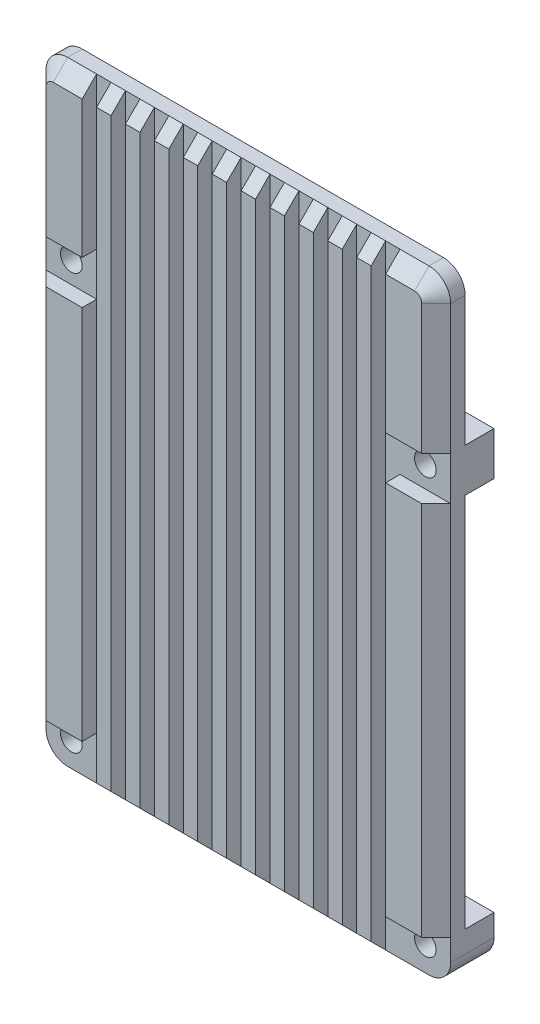
from build123d import *

# Parameters (mm, degrees)
SKETCH_4_R          = 1.5
EXTRUDE_1_DEPTH     = 4
CHAMFER_1_SIZE      = 2
SKETCH_5_W          = 2
SKETCH_5_H          = 85
CUT_EXTRUDE_1_DEPTH = 2
EXTRUDE_START       = 4
SKETCH_6_W          = 7
SKETCH_6_H          = 6
SKETCH_6_R          = 1.5
EXTRUDE_2_DEPTH     = 4


with BuildPart() as part:
    # 草图4 → 凸台-拉伸1 (new body)
    with BuildSketch(Plane.XY):
        with BuildLine():
            Line((0, 3), (0, 82))
            ThreePointArc((0, 82), (0.878679656, 84.121320344), (3, 85))
            Line((3, 85), (53, 85))
            ThreePointArc((53, 85), (55.121320344, 84.121320344), (56, 82))
            Line((56, 82), (56, 3))
            ThreePointArc((56, 3), (55.121320344, 0.878679656), (53, 0))
            Line((53, 0), (3, 0))
            ThreePointArc((3, 0), (0.878679656, 0.878679656), (0, 3))
        make_face()
        with Locations((3.5, 3.5)):
            Circle(SKETCH_4_R, mode=Mode.SUBTRACT)
        with Locations((52.5, 3.5)):
            Circle(SKETCH_4_R, mode=Mode.SUBTRACT)
        with Locations((52.5, 61)):
            Circle(SKETCH_4_R, mode=Mode.SUBTRACT)
        with Locations((3.5, 61)):
            Circle(SKETCH_4_R, mode=Mode.SUBTRACT)
    extrude(amount=EXTRUDE_1_DEPTH)

    # 倒角1
    chamfer_1_edges = [part.edges().sort_by_distance(p)[0] for p in [
        (55.121320344, 0.878679656, 4),
        (56, 42.5, 4),
        (55.121320344, 84.121320344, 4),
        (28, 85, 4),
        (0.878679656, 84.121320344, 4),
        (0, 42.5, 4),
        (0.878679656, 0.878679656, 4),
        (28, 0, 4),
    ]]
    chamfer(chamfer_1_edges, length=CHAMFER_1_SIZE - 0.0001)  # a hair under: the kernel refuses the full size

    # 草图5 → 切除-拉伸1 (cut)
    with BuildSketch(Plane.XY.offset(4)):
        Polygon((7, 64), (0, 64), (0, 58), (7, 58), (7, 6), (0, 6), (0, 0), (9, 0), (9, 85), (7, 85), align=None)
        Polygon((49, 58), (56, 58), (56, 64), (49, 64), (49, 85), (47, 85), (47, 0), (56, 0), (56, 6), (49, 6), align=None)
        with Locations((12, 42.5)):
            Rectangle(SKETCH_5_W, SKETCH_5_H)
        with Locations((16, 42.5)):
            Rectangle(SKETCH_5_W, SKETCH_5_H)
        with Locations((20, 42.5)):
            Rectangle(SKETCH_5_W, SKETCH_5_H)
        with Locations((24, 42.5)):
            Rectangle(SKETCH_5_W, SKETCH_5_H)
        with Locations((28, 42.5)):
            Rectangle(SKETCH_5_W, SKETCH_5_H)
        with Locations((32, 42.5)):
            Rectangle(SKETCH_5_W, SKETCH_5_H)
        with Locations((36, 42.5)):
            Rectangle(SKETCH_5_W, SKETCH_5_H)
        with Locations((40, 42.5)):
            Rectangle(SKETCH_5_W, SKETCH_5_H)
        with Locations((44, 42.5)):
            Rectangle(SKETCH_5_W, SKETCH_5_H)
    extrude(amount=-CUT_EXTRUDE_1_DEPTH, mode=Mode.SUBTRACT)

    # 草图6 → 凸台-拉伸2 (add)
    # profile 1 of 4: a face of its own
    with BuildSketch(Plane(origin=(0, 0, 0), x_dir=(-1, 0, 0), z_dir=(0, 0, -1)).offset(EXTRUDE_START)):
        with Locations((-52.5, 61)):
            Rectangle(SKETCH_6_W, SKETCH_6_H)
        with Locations((-52.5, 61)):
            Circle(SKETCH_6_R, mode=Mode.SUBTRACT)
    # profile 2 of 4: a face of its own
    with BuildSketch(Plane(origin=(0, 0, 0), x_dir=(-1, 0, 0), z_dir=(0, 0, -1)).offset(EXTRUDE_START)):
        with BuildLine():
            Line((-56, 6), (-49, 6))
            Line((-49, 6), (-49, 0))
            Line((-49, 0), (-53, 0))
            ThreePointArc((-53, 0), (-55.121320344, 0.878679656), (-56, 3))
            Line((-56, 3), (-56, 6))
        make_face()
        with Locations((-52.5, 3.5)):
            Circle(SKETCH_6_R, mode=Mode.SUBTRACT)
    # profile 3 of 4: a face of its own
    with BuildSketch(Plane(origin=(0, 0, 0), x_dir=(-1, 0, 0), z_dir=(0, 0, -1)).offset(EXTRUDE_START)):
        with BuildLine():
            Line((-7, 6), (0, 6))
            Line((0, 6), (0, 3))
            ThreePointArc((0, 3), (-0.878679656, 0.878679656), (-3, 0))
            Line((-3, 0), (-7, 0))
            Line((-7, 0), (-7, 6))
        make_face()
        with Locations((-3.5, 3.5)):
            Circle(SKETCH_6_R, mode=Mode.SUBTRACT)
    # profile 4 of 4: a face of its own
    with BuildSketch(Plane(origin=(0, 0, 0), x_dir=(-1, 0, 0), z_dir=(0, 0, -1)).offset(EXTRUDE_START)):
        with Locations((-3.5, 61)):
            Rectangle(SKETCH_6_W, SKETCH_6_H)
        with Locations((-3.5, 61)):
            Circle(SKETCH_6_R, mode=Mode.SUBTRACT)
    extrude(amount=-EXTRUDE_2_DEPTH)


solid = part.part
